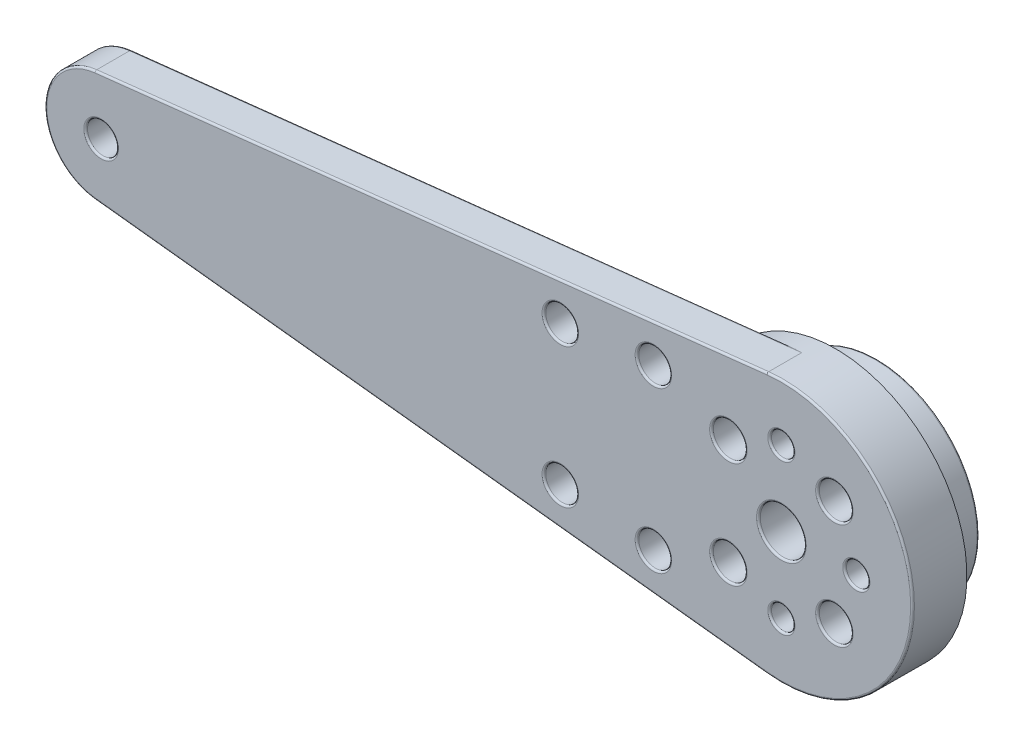
from build123d import *

# Parameters (mm, degrees)
SKETCH_1_R          = 1.7999999999999998
SKETCH_1_R_2        = 1.8000000000000007
SKETCH_1_R_3        = 1.6500000000000021
SKETCH_1_R_4        = 1.7500000000000004
SKETCH_1_R_5        = 1.7499999999999998
SKETCH_1_R_6        = 1.7500000000000009
EXTRUDE_1_DEPTH     = 3.9
EXTRUDE_START       = -6.300000000000001
SKETCH_1_6_R        = 10.9
SKETCH_1_6_R_2      = 1.7999999999999998
SKETCH_1_6_R_3      = 1.8000000000000007
SKETCH_1_6_R_4      = 4
EXTRUDE_2_DEPTH     = 6.300000000000001
EXTRUDE_START_2     = 1.9
SKETCH_3_R          = 10.9
EXTRUDE_3_DEPTH     = 1.9
SKETCH_4_R          = 2.45
CUT_EXTRUDE_2_DEPTH = 81.47625798954623
SKETCH_5_R          = 1.2499999999999998
SKETCH_5_R_2        = 1.2500000000000002
SKETCH_5_R_3        = 1.2499999999999991
CUT_EXTRUDE_3_DEPTH = 81.47625798954623
FILLET_2_R          = 0.2
FILLET_3_R          = 0.2


with BuildPart() as part:
    # 스케치1 → 보스-돌출1 (new body)
    with BuildSketch(Plane.XY):
        with BuildLine():
            Line((-73.25124810579969, 5.96345126102127), (-1.5429122468659604, 13.914719609049653))
            ThreePointArc((-1.5429122468659604, 13.914719609049653), (13.999999999999996, 3.11e-15), (-1.5429122468659573, -13.914719609049653))
            Line((-1.5429122468659573, -13.914719609049653), (-73.25124810579969, -5.963451261021289))
            ThreePointArc((-73.25124810579969, -5.963451261021289), (-78.59, -8.15e-15), (-73.25124810579969, 5.96345126102127))
        make_face()
        with Locations((5.656854249492369, 5.65685424949239)):
            Circle(SKETCH_1_R, mode=Mode.SUBTRACT)
        with Locations((5.65685424949239, -5.656854249492369)):
            Circle(SKETCH_1_R_2, mode=Mode.SUBTRACT)
        with Locations((-5.656854249492368, -5.656854249492391)):
            Circle(SKETCH_1_R, mode=Mode.SUBTRACT)
        with Locations((-5.656854249492391, 5.656854249492368)):
            Circle(SKETCH_1_R, mode=Mode.SUBTRACT)
        with Locations((-72.59, -8.89e-15)):
            Circle(SKETCH_1_R_3, mode=Mode.SUBTRACT)
        with Locations((-23.590000000000003, 7.445547090223239)):
            Circle(SKETCH_1_R_4, mode=Mode.SUBTRACT)
        with Locations((-13.656854249492396, 8.546968653787863)):
            Circle(SKETCH_1_R_5, mode=Mode.SUBTRACT)
        with Locations((-13.656854249492392, -8.546968653787866)):
            Circle(SKETCH_1_R_5, mode=Mode.SUBTRACT)
        with Locations((-23.590000000000003, -7.445547090223244)):
            Circle(SKETCH_1_R_6, mode=Mode.SUBTRACT)
    extrude(amount=EXTRUDE_1_DEPTH)

    # 스케치1<6> → 보스-돌출2 (add)
    # profile 1 of 2: a face of its own
    with BuildSketch(Plane.XY.offset(EXTRUDE_START)):
        Circle(SKETCH_1_6_R)
        with Locations((5.656854249492369, 5.65685424949239)):
            Circle(SKETCH_1_6_R_2, mode=Mode.SUBTRACT)
        with Locations((5.65685424949239, -5.656854249492369)):
            Circle(SKETCH_1_6_R_3, mode=Mode.SUBTRACT)
        with Locations((-5.656854249492368, -5.656854249492391)):
            Circle(SKETCH_1_6_R_2, mode=Mode.SUBTRACT)
        with Locations((-5.656854249492391, 5.656854249492368)):
            Circle(SKETCH_1_6_R_2, mode=Mode.SUBTRACT)
        Circle(SKETCH_1_6_R_4, mode=Mode.SUBTRACT)
    # profile 2 of 2: a face of its own
    with BuildSketch(Plane.XY.offset(EXTRUDE_START)):
        Circle(SKETCH_1_6_R_4)
    extrude(amount=EXTRUDE_2_DEPTH)

    # 스케치3 → 보스-돌출3 (add)
    with BuildSketch(Plane(origin=(0, 0, 0), x_dir=(-1, 0, 0), z_dir=(0, 0, -1)).offset(EXTRUDE_START_2)):
        with BuildLine():
            ThreePointArc((1.542912246865952, -13.914719609049655), (10.43074233830275, -9.33807337045166), (13.999999999999998, -3.43e-15))
            ThreePointArc((13.999999999999998, 0), (10.430742338302759, 9.338073370451651), (1.5429122468659615, 13.914719609049655))
            ThreePointArc((1.5429122468659602, 13.914719609049653), (-14, -2.2e-16), (1.5429122468659566, -13.914719609049659))
        make_face()
        with Locations(Location((0, 0, 0), (0, 0, 180))):
            Circle(SKETCH_3_R, mode=Mode.SUBTRACT)
    extrude(amount=-EXTRUDE_3_DEPTH)

    # 스케치4 → 컷-돌출2 (cut, through all)
    with BuildSketch(Plane(origin=(0, 0, -6.300000000000001), x_dir=(-1, 0, 0), z_dir=(0, 0, -1))):
        Circle(SKETCH_4_R)
    extrude(amount=-CUT_EXTRUDE_2_DEPTH, mode=Mode.SUBTRACT)

    # 스케치5 → 컷-돌출3 (cut, through all)
    with BuildSketch(Plane.XY.offset(3.9)):
        with Locations((7.3e-16, 8)):
            Circle(SKETCH_5_R)
        with Locations((2.69e-15, -8)):
            Circle(SKETCH_5_R_2)
        with Locations((8, 0)):
            Circle(SKETCH_5_R_3)
    extrude(amount=-CUT_EXTRUDE_3_DEPTH, mode=Mode.SUBTRACT)

    # 필렛2
    fillet_2_edges = [part.edges().sort_by_distance(p)[0] for p in [
        (-15.406854249492392, -8.546968653787866, 3.9),
        (-15.406854249492396, 8.546968653787863, 3.9),
        (-25.340000000000003, 7.445547090223239, 3.9),
        (-74.24000000000001, -9.42e-15, 3.9),
        (-37.39708017633283, 9.939085435035462, 3.9),
        (-78.59000000000002, -9.77e-15, 3.9),
        (-10.9, 1.33e-15, -6.300000000000001),
        (-7.456854249492391, 5.656854249492368, -6.300000000000001),
        (-7.456854249492368, -5.656854249492391, -6.300000000000001),
        (-37.39708017633283, -9.939085435035471, 3.9),
        (3.8568542494923896, -5.65685424949237, -6.300000000000001),
        (3.856854249492369, 5.65685424949239, -6.300000000000001),
        (13.999999999999998, 2e-15, 3.9),
        (-25.340000000000003, -7.445547090223244, 3.9),
        (-7.456854249492391, 5.656854249492368, 3.9),
        (-7.456854249492368, -5.656854249492391, 3.9),
        (2.45, 3e-16, 3.9000000000000004),
        (3.8568542494923896, -5.65685424949237, 3.9),
        (2.45, 3e-16, -6.300000000000001),
        (3.856854249492369, 5.65685424949239, 3.9),
        (-1.2499999999999991, 8, -6.300000000000001),
        (-1.2499999999999991, 8, 3.9),
        (6.750000000000001, 1.5e-16, -6.300000000000001),
        (6.750000000000001, 1.5e-16, 3.9),
        (-1.2499999999999976, -8, -6.300000000000001),
        (-1.2499999999999976, -8, 3.9),
    ]]
    fillet(fillet_2_edges, radius=FILLET_2_R)

    # 필렛3
    # the kernel refuses this fillet: 0.2 mm, written as the material it takes off along each edge
    with BuildSketch(Plane(origin=(-23.590000000000003, -7.445547090223244, 0), x_dir=(1, 0, 0), z_dir=(0, -1, 0))) as fillet_3_piece_1:
        with BuildLine():
            CenterArc((1.75 + FILLET_3_R, FILLET_3_R), FILLET_3_R, 180, 90)
            Line((1.75, FILLET_3_R), (1.75, 0))
            Line((1.75, 0), (1.75 + FILLET_3_R, 0))
        make_face()
    revolve(axis=Axis((-23.590000000000003, -7.445547090223244, 0), (0, 0, 1)), mode=Mode.SUBTRACT)
    with BuildSketch(Plane(origin=(-1.0459579751141845, -13.969823617866295, 0), x_dir=(0.11020801763328267, 0.993908543503547, 0), z_dir=(-0.993908543503547, 0.11020801763328267, 0))) as fillet_3_piece_2_section:
        with BuildLine():
            CenterArc((FILLET_3_R, -FILLET_3_R), FILLET_3_R, 90, 90)
            Line((0, -FILLET_3_R), (0, 0))
            Line((0, 0), (FILLET_3_R, 0))
        make_face()
    fillet_3_piece_2 = extrude(amount=72.64782117292246, mode=Mode.PRIVATE)
    fillet_3_piece_2 = fillet_3_piece_2 - Plane(origin=(4.4e-16, 8.9e-16, 0.0449378973195656), x_dir=(-0.11020801763328296, 0.993908543503547, 0), z_dir=(0, 0, -1)) * Cylinder(13.999999999999998, 147, mode=Mode.PRIVATE)
    add(fillet_3_piece_2, mode=Mode.SUBTRACT)
    with BuildSketch(Plane(origin=(-72.59000000000002, -9.55e-15, 0), x_dir=(-0.11020801763327874, -0.9939085435035473, 0), z_dir=(0.9939085435035473, -0.11020801763327874, 0))) as fillet_3_piece_3:
        with BuildLine():
            CenterArc((5.999999999999993 - FILLET_3_R, -FILLET_3_R), FILLET_3_R, 0, 90)
            Line((5.999999999999993 - FILLET_3_R, 3e-17), (5.999999999999993, 0))
            Line((5.999999999999993, 0), (5.999999999999993, -FILLET_3_R))
        make_face()
    revolve(axis=Axis((-72.59000000000002, -9.55e-15, 0), (0, 0, -1)), revolution_arc=167.34538598213177, mode=Mode.SUBTRACT)
    with BuildSketch(Plane(origin=(-73.25124810579969, 5.96345126102127, 0), x_dir=(0, 0, 1), z_dir=(0.9939085435035471, 0.11020801763328296, 0))) as fillet_3_piece_4_section:
        with BuildLine():
            CenterArc((FILLET_3_R, FILLET_3_R), FILLET_3_R, 180, 90)
            Line((-3e-17, FILLET_3_R), (0, 0))
            Line((0, 0), (FILLET_3_R, 0))
        make_face()
    fillet_3_piece_4 = extrude(amount=72.64782117292248, mode=Mode.PRIVATE)
    fillet_3_piece_4 = fillet_3_piece_4 - Plane(origin=(4.4e-16, 8.9e-16, 0.04493768276162775), x_dir=(-0.11020801763328296, 0.993908543503547, 0), z_dir=(0, 0, -1)) * Cylinder(13.999999999999998, 147, mode=Mode.PRIVATE)
    add(fillet_3_piece_4, mode=Mode.SUBTRACT)
    with BuildSketch(Plane(origin=(-72.59, -8.89e-15, 0), x_dir=(1, 0, 0), z_dir=(0, -1, 0))) as fillet_3_piece_5:
        with BuildLine():
            CenterArc((1.6500000000000057 + FILLET_3_R, FILLET_3_R), FILLET_3_R, 180, 90)
            Line((1.6500000000000057, FILLET_3_R), (1.6500000000000057, 0))
            Line((1.6500000000000057, 0), (1.6500000000000057 + FILLET_3_R, 0))
        make_face()
    revolve(axis=Axis((-72.59, -8.89e-15, 0), (0, 0, 1)), mode=Mode.SUBTRACT)
    with BuildSketch(Plane(origin=(-23.590000000000003, 7.445547090223239, 0), x_dir=(1, 0, 0), z_dir=(0, -1, 0))) as fillet_3_piece_6:
        with BuildLine():
            CenterArc((1.75 + FILLET_3_R, FILLET_3_R), FILLET_3_R, 180, 90)
            Line((1.75, FILLET_3_R), (1.75, 0))
            Line((1.75, 0), (1.75 + FILLET_3_R, 0))
        make_face()
    revolve(axis=Axis((-23.590000000000003, 7.445547090223239, 0), (0, 0, 1)), mode=Mode.SUBTRACT)
    with BuildSketch(Plane(origin=(-13.656854249492396, 8.546968653787863, 0), x_dir=(1, 0, 0), z_dir=(0, -1, 0))) as fillet_3_piece_7:
        with BuildLine():
            CenterArc((1.75 + FILLET_3_R, FILLET_3_R), FILLET_3_R, 180, 90)
            Line((1.7499999999999982, FILLET_3_R), (1.75, 0))
            Line((1.75, 0), (1.75 + FILLET_3_R, 0))
        make_face()
    revolve(axis=Axis((-13.656854249492396, 8.546968653787863, 0), (0, 0, 1)), mode=Mode.SUBTRACT)
    with BuildSketch(Plane(origin=(-13.656854249492392, -8.546968653787866, 0), x_dir=(1, 0, 0), z_dir=(0, -1, 0))) as fillet_3_piece_8:
        with BuildLine():
            CenterArc((1.75 + FILLET_3_R, FILLET_3_R), FILLET_3_R, 180, 90)
            Line((1.7500000000000018, FILLET_3_R), (1.75, 0))
            Line((1.75, 0), (1.75 + FILLET_3_R, 0))
        make_face()
    revolve(axis=Axis((-13.656854249492392, -8.546968653787866, 0), (0, 0, 1)), mode=Mode.SUBTRACT)


solid = part.part
